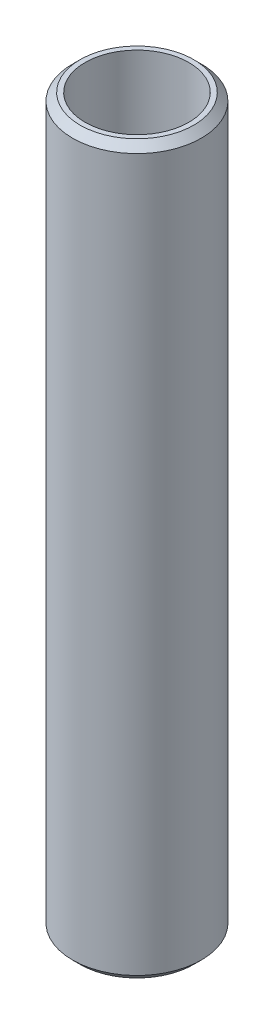
from build123d import *

# Parameters (mm, degrees)
SKETCH1_R           = 27.5
BOSS_EXTRUDE1_DEPTH = 310.607577266
SKETCH2_R           = 22.161489638
CUT_EXTRUDE1_DEPTH  = 314.032852997
CHAMFER1_SIZE       = 3.217672791


with BuildPart() as part:
    # Sketch1 → Boss-Extrude1 (new body)
    with BuildSketch(Plane(origin=(0, 0, 0), x_dir=(1, 0, 0), z_dir=(0, 1, 0))):
        Circle(SKETCH1_R)
    extrude(amount=BOSS_EXTRUDE1_DEPTH)

    # Sketch2 → Cut-Extrude1 (cut, through all)
    with BuildSketch(Plane(origin=(0, 0, 0), x_dir=(1, 0, 0), z_dir=(0, 1, 0))):
        Circle(SKETCH2_R)
    extrude(amount=CUT_EXTRUDE1_DEPTH, mode=Mode.SUBTRACT)

    # Chamfer1
    chamfer1_edges = [part.edges().sort_by_distance(p)[0] for p in [
        (-27.5, 310.607577266, 0),
        (-27.5, 0, 0),
    ]]
    chamfer(chamfer1_edges, length=CHAMFER1_SIZE)


solid = part.part
